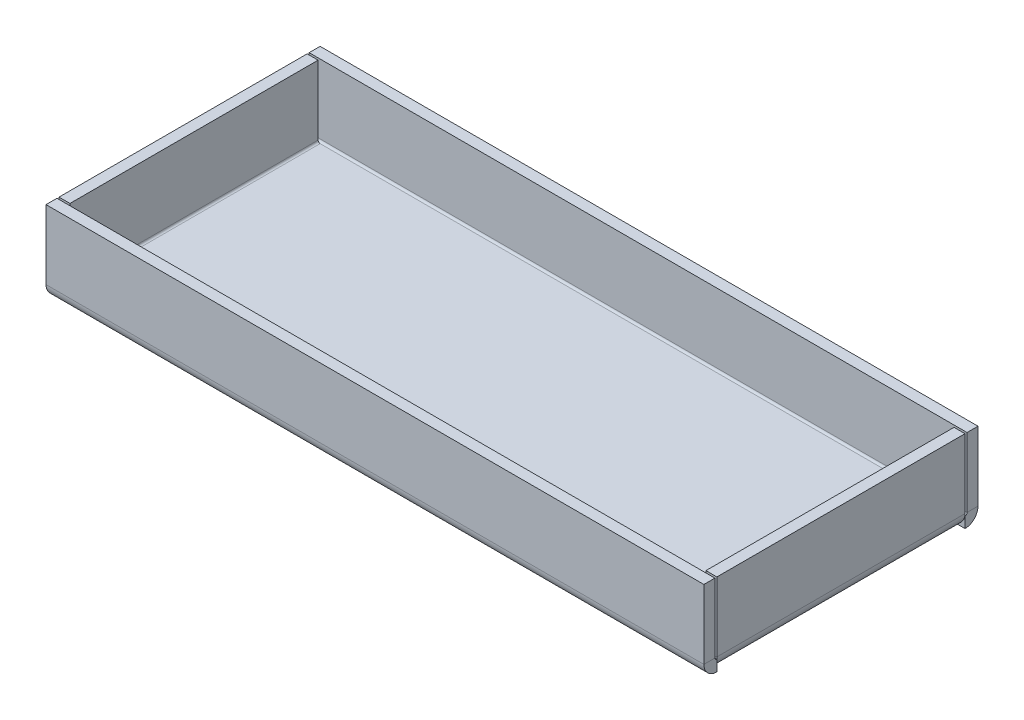
from build123d import *

# Parameters (mm, degrees)
CROQUIS2_W                         = 240
CROQUIS2_H                         = 100
BRIDA_BASE1_DEPTH                  = 4
BRIDA_DE_ARISTA1_STRIP_W           = 17.4732
BRIDA_DE_ARISTA1_STRIP_H           = 4
BRIDA_DE_ARISTA1_STRIP_CUT_DEPTH   = 240
BRIDA_DE_ARISTA1_STRIP_2_W         = 17.4732
BRIDA_DE_ARISTA1_STRIP_2_H         = 4
BRIDA_DE_ARISTA1_STRIP_CUT_2_DEPTH = 240
BRIDA_DE_ARISTA1_DEPTH             = 240
BRIDA_DE_ARISTA1_BEND_DEPTH        = 240
BRIDA_DE_ARISTA2_STRIP_W           = 17.4732
BRIDA_DE_ARISTA2_STRIP_H           = 4
BRIDA_DE_ARISTA2_STRIP_CUT_DEPTH   = 90.5268
BRIDA_DE_ARISTA2_STRIP_2_W         = 17.4732
BRIDA_DE_ARISTA2_STRIP_2_H         = 4
BRIDA_DE_ARISTA2_STRIP_CUT_2_DEPTH = 90.5268
BRIDA_DE_ARISTA2_DEPTH             = 90.5268
BRIDA_DE_ARISTA2_BEND_DEPTH        = 90.5268


# Sheet-metal steps are written as plain solids
with BuildPart() as part:
    # Croquis2 → Brida base1 (new body)
    with BuildSketch(Plane(origin=(0, 0, 0), x_dir=(1, 0, 0), z_dir=(0, 1, 0))):
        with Locations((120, 50)):
            Rectangle(CROQUIS2_W, CROQUIS2_H)
    extrude(amount=BRIDA_BASE1_DEPTH)

    # Brida de arista1 strip (across the edge) → Brida de arista1 strip cut (cut)
    with BuildSketch(Plane(origin=(0, 4, 0), x_dir=(0, 0, -1), z_dir=(1, 0, 0))):
        with Locations((-4, -2)):
            Rectangle(BRIDA_DE_ARISTA1_STRIP_W, BRIDA_DE_ARISTA1_STRIP_H)
    extrude(amount=BRIDA_DE_ARISTA1_STRIP_CUT_DEPTH, mode=Mode.SUBTRACT)

    # Brida de arista1 strip 2 (across the edge) → Brida de arista1 strip cut 2 (cut)
    with BuildSketch(Plane(origin=(240, 4, -100), x_dir=(0, 0, 1), z_dir=(-1, 0, 0))):
        with Locations((-4, -2)):
            Rectangle(BRIDA_DE_ARISTA1_STRIP_2_W, BRIDA_DE_ARISTA1_STRIP_2_H)
    extrude(amount=BRIDA_DE_ARISTA1_STRIP_CUT_2_DEPTH, mode=Mode.SUBTRACT)

    # Brida de arista1 section (across the edge) → Brida de arista1 (add)
    with BuildSketch(Plane(origin=(0, 4, 0), x_dir=(0, 0, -1), z_dir=(1, 0, 0))):
        with BuildLine():
            Line((0, 0.7366), (0, 26))
            Line((0, 26), (4, 26))
            Line((4, 26), (4, 0.7366))
            ThreePointArc((4, 0.7366), (4.215745145, 0.215745145), (4.7366, 0))
            Line((4.7366, 0), (4.7366, -4))
            ThreePointArc((4.7366, -4), (1.38731802, -2.61268198), (0, 0.7366))
        make_face()
    extrude(amount=BRIDA_DE_ARISTA1_DEPTH)

    # Brida de arista1 section 2 (across the edge) → Brida de arista1 bend (add)
    with BuildSketch(Plane(origin=(240, 4, -100), x_dir=(0, 0, 1), z_dir=(-1, 0, 0))):
        with BuildLine():
            Line((0, 0.7366), (0, 26))
            Line((0, 26), (4, 26))
            Line((4, 26), (4, 0.7366))
            ThreePointArc((4, 0.7366), (4.215745145, 0.215745145), (4.7366, 0))
            Line((4.7366, 0), (4.7366, -4))
            ThreePointArc((4.7366, -4), (1.38731802, -2.61268198), (0, 0.7366))
        make_face()
    extrude(amount=BRIDA_DE_ARISTA1_BEND_DEPTH)

    # Brida de arista2 strip (across the edge) → Brida de arista2 strip cut (cut)
    with BuildSketch(Plane(origin=(240, 4, -4.7366), x_dir=(-1, 0, 0), z_dir=(0, 0, -1))):
        with Locations((-4, -2)):
            Rectangle(BRIDA_DE_ARISTA2_STRIP_W, BRIDA_DE_ARISTA2_STRIP_H)
    extrude(amount=BRIDA_DE_ARISTA2_STRIP_CUT_DEPTH, mode=Mode.SUBTRACT)

    # Brida de arista2 strip 2 (across the edge) → Brida de arista2 strip cut 2 (cut)
    with BuildSketch(Plane(origin=(0, 4, -95.2634), x_dir=(1, 0, 0), z_dir=(0, 0, 1))):
        with Locations((-4, -2)):
            Rectangle(BRIDA_DE_ARISTA2_STRIP_2_W, BRIDA_DE_ARISTA2_STRIP_2_H)
    extrude(amount=BRIDA_DE_ARISTA2_STRIP_CUT_2_DEPTH, mode=Mode.SUBTRACT)

    # Brida de arista2 section (across the edge) → Brida de arista2 (add)
    with BuildSketch(Plane(origin=(240, 4, -4.7366), x_dir=(-1, 0, 0), z_dir=(0, 0, -1))):
        with BuildLine():
            Line((0, 0.7366), (0, 26))
            Line((0, 26), (4, 26))
            Line((4, 26), (4, 0.7366))
            ThreePointArc((4, 0.7366), (4.215745145, 0.215745145), (4.7366, 0))
            Line((4.7366, 0), (4.7366, -4))
            ThreePointArc((4.7366, -4), (1.38731802, -2.61268198), (0, 0.7366))
        make_face()
    extrude(amount=BRIDA_DE_ARISTA2_DEPTH)

    # Brida de arista2 section 2 (across the edge) → Brida de arista2 bend (add)
    with BuildSketch(Plane(origin=(0, 4, -95.2634), x_dir=(1, 0, 0), z_dir=(0, 0, 1))):
        with BuildLine():
            Line((0, 0.7366), (0, 26))
            Line((0, 26), (4, 26))
            Line((4, 26), (4, 0.7366))
            ThreePointArc((4, 0.7366), (4.215745145, 0.215745145), (4.7366, 0))
            Line((4.7366, 0), (4.7366, -4))
            ThreePointArc((4.7366, -4), (1.38731802, -2.61268198), (0, 0.7366))
        make_face()
    extrude(amount=BRIDA_DE_ARISTA2_BEND_DEPTH)


solid = part.part
